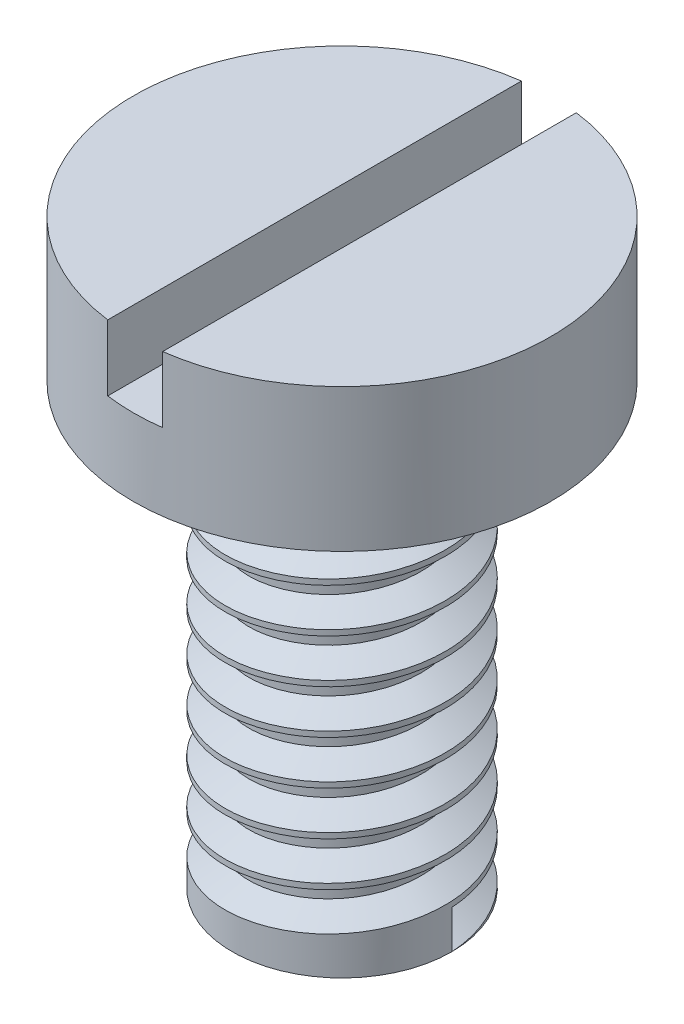
from build123d import *

# Parameters (mm, degrees)
SKETCH1_R           = 1.9
BOSS_EXTRUDE1_DEPTH = 1.3
SKETCH2_R           = 1
BOSS_EXTRUDE2_DEPTH = 4
THREAD1_PITCH       = 0.4
SKETCH6_W           = 0.5
SKETCH6_H           = 4
CUT_EXTRUDE1_DEPTH  = 0.6


with BuildPart() as part:
    # Sketch1 → Boss-Extrude1 (new body)
    with BuildSketch(Plane(origin=(0, 0, 0), x_dir=(1, 0, 0), z_dir=(0, 1, 0))):
        with Locations(Location((0, 0, 0), (0, 0, 270))):
            Circle(SKETCH1_R)
    extrude(amount=BOSS_EXTRUDE1_DEPTH)

    # Sketch2 → Boss-Extrude2 (add)
    with BuildSketch(Plane.XZ):
        with Locations(Location((0, 0, 0), (0, 0, 270))):
            Circle(SKETCH2_R)
    extrude(amount=BOSS_EXTRUDE2_DEPTH)

    # Thread1: the profile of Thread Profile1 profile screwed along a right-hand helix of 10 turns, 6 arcs to a turn; built about Z, then put on its axis
    thread1_z = Axis((0, 0, 0), (0, 0, 1))
    thread1_corners = [(1.0003, 0, -0.000173205), (1.0003, 0, 0.350173204), (0.78349365, 0, 0.224999999), (0.78349365, 0, 0.124999999)]
    with BuildLine(mode=Mode.PRIVATE) as thread1_profile:
        Line(thread1_corners[0], thread1_corners[1])
        Line(thread1_corners[1], thread1_corners[2])
        Line(thread1_corners[2], thread1_corners[3])
        Line(thread1_corners[3], thread1_corners[0])
    thread1_cap = Face(thread1_profile.wire())
    thread1_turn_angles = [0, 30, 60, 90, 120, 150, 180, 210, 240, 270, 300, 330, 360]
    thread1_turn_weights = [1, 0.8660254037844387, 1, 0.8660254037844387, 1, 0.8660254037844387, 1, 0.8660254037844387, 1, 0.8660254037844387, 1, 0.8660254037844387, 1]
    thread1_turn_rails = [Edge.make_bspline([Vector(p[0], p[1], 0).rotate(thread1_z, thread1_turn_angles[k]) / thread1_turn_weights[k] + Vector(0, 0, p[2] + THREAD1_PITCH * thread1_turn_angles[k] / 360) for k in range(13)], [0, 0, 0, 1, 1, 2, 2, 3, 3, 4, 4, 5, 5, 6, 6, 6], 2, thread1_turn_weights) for p in thread1_corners]
    thread1_turn_sides = [Face.make_surface_from_curves(thread1_turn_rails[p[0]], thread1_turn_rails[p[1]]) for p in [(0, 1), (1, 2), (2, 3), (3, 0)]]
    thread1 = Plane(origin=(0, -4, 0), x_dir=(1, 0, 0), z_dir=(0, 1, 0)) * Solid(Shell([*[p.moved(Location((0, 0, THREAD1_PITCH * i))) for i in range(10) for p in thread1_turn_sides], thread1_cap, thread1_cap.rotate(thread1_z, 3600).moved(Location((0, 0, THREAD1_PITCH * 3600 / 360)))]))
    add(thread1, mode=Mode.SUBTRACT)

    # Sketch6 → Cut-Extrude1 (cut)
    with BuildSketch(Plane(origin=(0, 1.3, 0), x_dir=(1, 0, 0), z_dir=(0, 1, 0))):
        Rectangle(SKETCH6_W, SKETCH6_H)
    extrude(amount=-CUT_EXTRUDE1_DEPTH, mode=Mode.SUBTRACT)


solid = part.part
